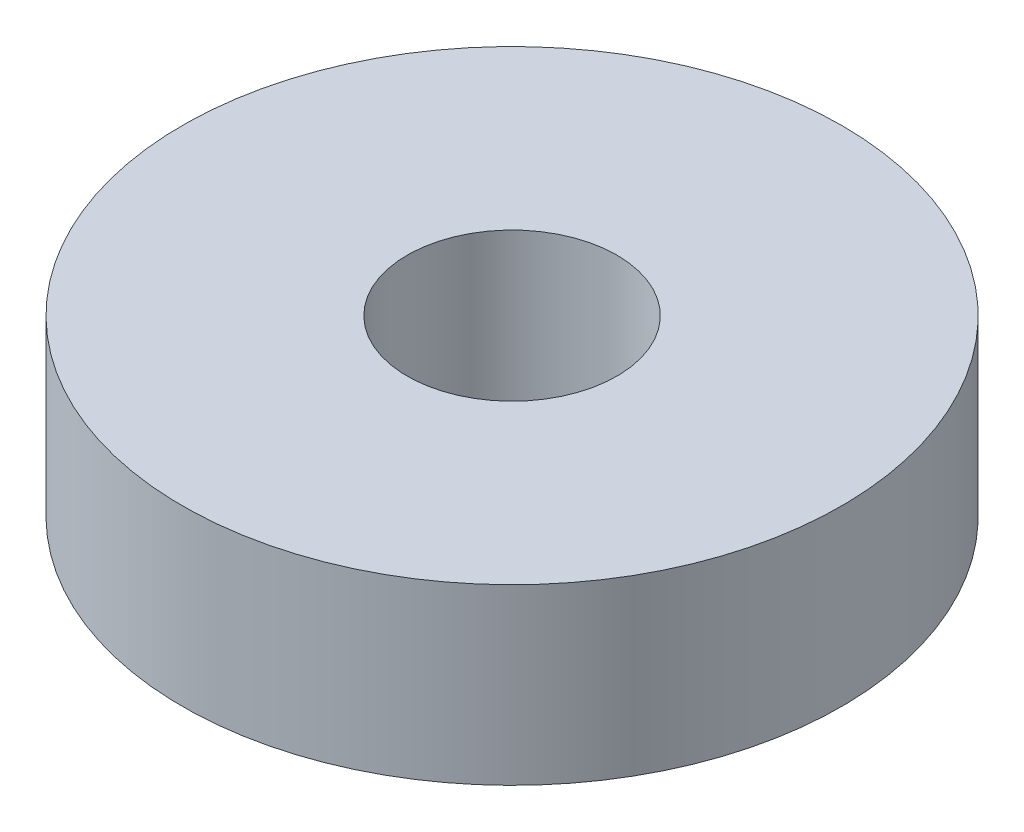
from build123d import *

# Parameters (mm, degrees)
SKETCH1_R           = 55
BOSS_EXTRUDE1_DEPTH = 29
SKETCH2_R           = 17.5
CUT_EXTRUDE1_DEPTH  = 84.012047318


with BuildPart() as part:
    # Sketch1 → Boss-Extrude1 (new body)
    with BuildSketch(Plane(origin=(0, 0, 0), x_dir=(1, 0, 0), z_dir=(0, 1, 0))):
        Circle(SKETCH1_R)
    extrude(amount=BOSS_EXTRUDE1_DEPTH)

    # Sketch2 → Cut-Extrude1 (cut, through all)
    with BuildSketch(Plane(origin=(0, 0, 0), x_dir=(1, 0, 0), z_dir=(0, 1, 0))):
        Circle(SKETCH2_R)
    extrude(amount=CUT_EXTRUDE1_DEPTH, mode=Mode.SUBTRACT)


solid = part.part
